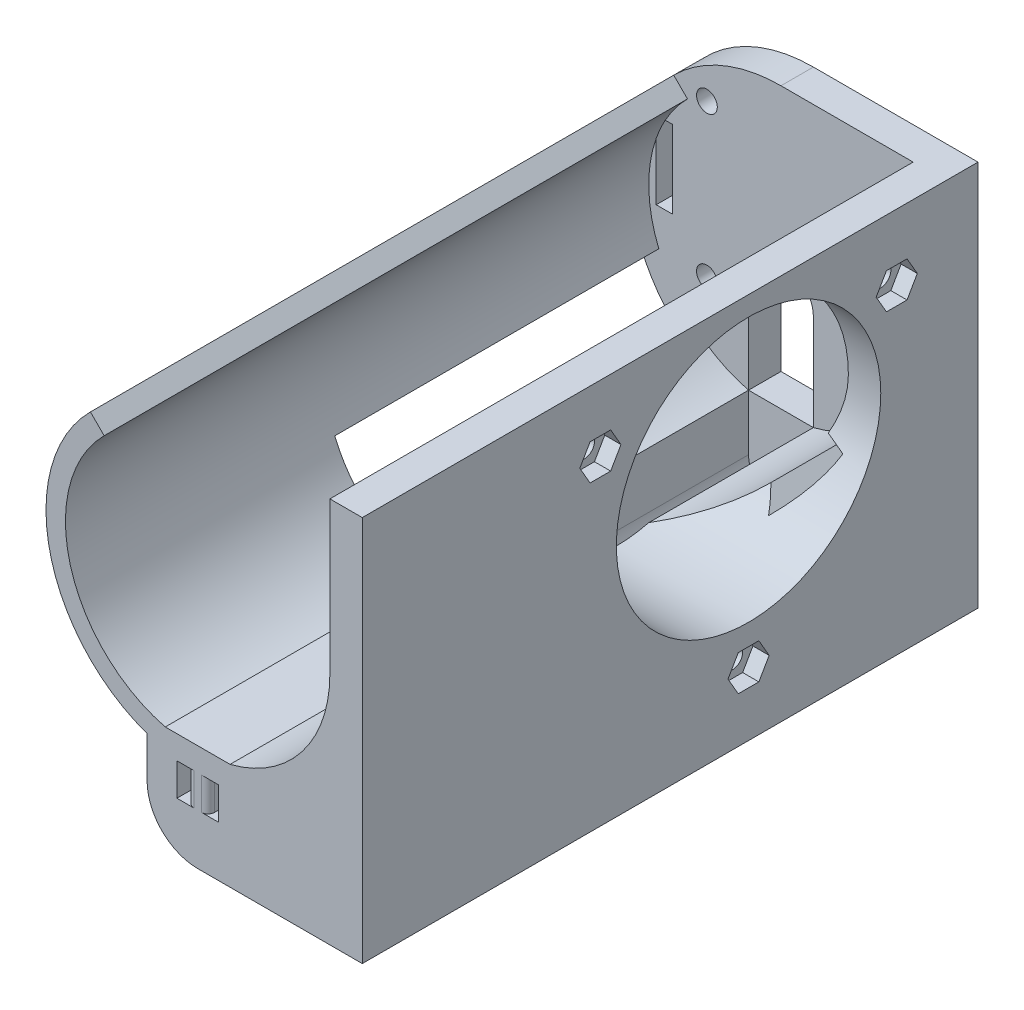
from build123d import *

# Parameters (mm, degrees)
BOSS_EXTRUDE3_DEPTH  = 40
BOSS_EXTRUDE7_START  = -50
BOSS_EXTRUDE7_DEPTH  = 50
BOSS_EXTRUDE8_START  = -3
SKETCH3_W            = 1.6
SKETCH3_H            = 5
BOSS_EXTRUDE8_DEPTH  = 3
SKETCH5_W            = 10
SKETCH5_H            = 3
BOSS_EXTRUDE9_DEPTH  = 37
BOSS_EXTRUDE10_START = -90
BOSS_EXTRUDE10_DEPTH = 90
SKETCH8_R            = 20.4
CUT_EXTRUDE1_DEPTH   = 67.750280898
CUT_EXTRUDE2_DEPTH   = 2.5
SKETCH10_R           = 1.6
CUT_EXTRUDE3_DEPTH   = 2.5
FILLET1_R            = 1
BOSS_EXTRUDE12_START = -50
BOSS_EXTRUDE12_DEPTH = 90
BOSS_EXTRUDE13_START = 5
BOSS_EXTRUDE13_DEPTH = 5
SKETCH12_R           = 1.6
CUT_EXTRUDE4_DEPTH   = 2.5
SKETCH12_4_R         = 1.6
SKETCH12_4_W         = 2.5
SKETCH12_4_H         = 12
CUT_EXTRUDE5_DEPTH   = 5


with BuildPart() as part:
    # Sketch1 → Boss-Extrude3 (new body)
    with BuildSketch(Plane.XY):
        with BuildLine():
            Line((8.954792317, -21.618781061), (7.80674202, -18.847142463))
            ThreePointArc((7.80674202, -18.847142463), (6.420255058, -19.363375868), (5, -19.777765293))
            Line((5, -19.777765293), (5, -28.4))
            ThreePointArc((5, -28.4), (0, -33.4), (-5, -28.4))
            Line((-5, -28.4), (-5, -19.777765293))
            ThreePointArc((-5, -19.777765293), (-6.420255058, -19.363375868), (-7.80674202, -18.847142463))
            Line((-7.80674202, -18.847142463), (-8.954792317, -21.618781061))
            ThreePointArc((-8.954792317, -21.618781061), (-8.380323245, -21.847887365), (-7.8, -22.061731573))
            Line((-7.8, -22.061731573), (-7.8, -28.4))
            ThreePointArc((-7.8, -28.4), (0, -36.2), (7.8, -28.4))
            Line((7.8, -28.4), (7.8, -22.061731573))
            ThreePointArc((7.8, -22.061731573), (8.380323245, -21.847887365), (8.954792317, -21.618781061))
        make_face()
        with BuildLine():
            Line((16.54629868, -16.54629868), (14.424978336, -14.424978336))
            ThreePointArc((14.424978336, -14.424978336), (11.333632754, -16.961980091), (7.80674202, -18.847142463))
            Line((7.80674202, -18.847142463), (8.954792317, -21.618781061))
            ThreePointArc((8.954792317, -21.618781061), (13.000343453, -19.456388928), (16.54629868, -16.54629868))
        make_face()
        with BuildLine():
            ThreePointArc((-7.80674202, -18.847142463), (-11.333632754, -16.961980091), (-14.424978336, -14.424978336))
            Line((-14.424978336, -14.424978336), (-16.54629868, -16.54629868))
            ThreePointArc((-16.54629868, -16.54629868), (-13.000343453, -19.456388928), (-8.954792317, -21.618781061))
            Line((-8.954792317, -21.618781061), (-7.80674202, -18.847142463))
        make_face()
        with BuildLine():
            ThreePointArc((-18.847142463, -7.80674202), (-20.00801972, -3.979842569), (-20.4, 0))
            Line((-20.4, 0), (-23.4, 0))
            ThreePointArc((-23.4, 0), (-22.950375561, -4.565113535), (-21.618781061, -8.954792317))
            Line((-21.618781061, -8.954792317), (-18.847142463, -7.80674202))
        make_face()
        with BuildLine():
            Line((21.618781061, -8.954792317), (18.847142463, -7.80674202))
            ThreePointArc((18.847142463, -7.80674202), (16.961980091, -11.333632754), (14.424978336, -14.424978336))
            Line((14.424978336, -14.424978336), (16.54629868, -16.54629868))
            ThreePointArc((16.54629868, -16.54629868), (19.456388928, -13.000343453), (21.618781061, -8.954792317))
        make_face()
        with BuildLine():
            Line((23.4, 0), (20.4, 0))
            ThreePointArc((20.4, 0), (20.00801972, -3.979842569), (18.847142463, -7.80674202))
            Line((18.847142463, -7.80674202), (21.618781061, -8.954792317))
            ThreePointArc((21.618781061, -8.954792317), (22.950375561, -4.565113535), (23.4, 0))
        make_face()
        with BuildLine():
            ThreePointArc((-14.424978336, -14.424978336), (-16.961980091, -11.333632754), (-18.847142463, -7.80674202))
            Line((-18.847142463, -7.80674202), (-21.618781061, -8.954792317))
            ThreePointArc((-21.618781061, -8.954792317), (-19.456388928, -13.000343453), (-16.54629868, -16.54629868))
            Line((-16.54629868, -16.54629868), (-14.424978336, -14.424978336))
        make_face()
    extrude(amount=BOSS_EXTRUDE3_DEPTH)

    # Sketch1<12> → Boss-Extrude7 (add)
    with BuildSketch(Plane.XY.offset(BOSS_EXTRUDE7_START)):
        with BuildLine():
            Line((16.54629868, -16.54629868), (14.424978336, -14.424978336))
            ThreePointArc((14.424978336, -14.424978336), (11.333632754, -16.961980091), (7.80674202, -18.847142463))
            Line((7.80674202, -18.847142463), (8.954792317, -21.618781061))
            ThreePointArc((8.954792317, -21.618781061), (13.000343453, -19.456388928), (16.54629868, -16.54629868))
        make_face()
        with BuildLine():
            Line((8.954792317, -21.618781061), (7.80674202, -18.847142463))
            ThreePointArc((7.80674202, -18.847142463), (6.420255058, -19.363375868), (5, -19.777765293))
            Line((5, -19.777765293), (5, -28.4))
            ThreePointArc((5, -28.4), (0, -33.4), (-5, -28.4))
            Line((-5, -28.4), (-5, -19.777765293))
            ThreePointArc((-5, -19.777765293), (-6.420255058, -19.363375868), (-7.80674202, -18.847142463))
            Line((-7.80674202, -18.847142463), (-8.954792317, -21.618781061))
            ThreePointArc((-8.954792317, -21.618781061), (-8.380323245, -21.847887365), (-7.8, -22.061731573))
            Line((-7.8, -22.061731573), (-7.8, -28.4))
            ThreePointArc((-7.8, -28.4), (0, -36.2), (7.8, -28.4))
            Line((7.8, -28.4), (7.8, -22.061731573))
            ThreePointArc((7.8, -22.061731573), (8.380323245, -21.847887365), (8.954792317, -21.618781061))
        make_face()
        with BuildLine():
            ThreePointArc((-18.847142463, -7.80674202), (-20.00801972, -3.979842569), (-20.4, 0))
            Line((-20.4, 0), (-23.4, 0))
            ThreePointArc((-23.4, 0), (-22.950375561, -4.565113535), (-21.618781061, -8.954792317))
            Line((-21.618781061, -8.954792317), (-18.847142463, -7.80674202))
        make_face()
        with BuildLine():
            Line((23.4, 0), (20.4, 0))
            ThreePointArc((20.4, 0), (20.00801972, -3.979842569), (18.847142463, -7.80674202))
            Line((18.847142463, -7.80674202), (21.618781061, -8.954792317))
            ThreePointArc((21.618781061, -8.954792317), (22.950375561, -4.565113535), (23.4, 0))
        make_face()
        with BuildLine():
            ThreePointArc((-7.80674202, -18.847142463), (-11.333632754, -16.961980091), (-14.424978336, -14.424978336))
            Line((-14.424978336, -14.424978336), (-16.54629868, -16.54629868))
            ThreePointArc((-16.54629868, -16.54629868), (-13.000343453, -19.456388928), (-8.954792317, -21.618781061))
            Line((-8.954792317, -21.618781061), (-7.80674202, -18.847142463))
        make_face()
    extrude(amount=BOSS_EXTRUDE7_DEPTH)

    # Sketch3 → Boss-Extrude8 (add)
    with BuildSketch(Plane.XY.offset(40).offset(BOSS_EXTRUDE8_START)):
        with BuildLine():
            Line((-5, -19.777765293), (5, -19.777765293))
            Line((5, -19.777765293), (5, -28.4))
            ThreePointArc((5, -28.4), (0, -33.4), (-5, -28.4))
            Line((-5, -28.4), (-5, -19.777765293))
        make_face()
        with Locations((2.4, -25.9)):
            Rectangle(SKETCH3_W, SKETCH3_H, mode=Mode.SUBTRACT)
        with Locations((-2.4, -25.9)):
            Rectangle(SKETCH3_W, SKETCH3_H, mode=Mode.SUBTRACT)
    extrude(amount=BOSS_EXTRUDE8_DEPTH)

    # Sketch5 → Boss-Extrude9 (add)
    with BuildSketch(Plane(origin=(0, 0, 37), x_dir=(-1, 0, 0), z_dir=(0, 0, -1))):
        with Locations((0, -21.277765293)):
            Rectangle(SKETCH5_W, SKETCH5_H)
    extrude(amount=BOSS_EXTRUDE9_DEPTH)

    # Sketch6 → Boss-Extrude10 (add)
    with BuildSketch(Plane.XY.offset(40).offset(BOSS_EXTRUDE10_START)):
        with BuildLine():
            Line((20.4, 0), (20.4, 23.4))
            Line((20.4, 23.4), (25.4, 23.4))
            Line((25.4, 23.4), (25.4, -36.2))
            Line((25.4, -36.2), (0, -36.2))
            ThreePointArc((0, -36.2), (5.515432893, -33.915432893), (7.8, -28.4))
            Line((7.8, -28.4), (7.8, -22.061731573))
            ThreePointArc((7.8, -22.061731573), (19.106019994, -13.509996299), (23.4, 0))
            Line((23.4, 0), (20.4, 0))
        make_face()
    extrude(amount=BOSS_EXTRUDE10_DEPTH)

    # Sketch8 → Cut-Extrude1 (cut, through all)
    with BuildSketch(Plane(origin=(0, 0, 0), x_dir=(0, 0, -1), z_dir=(1, 0, 0))):
        with Locations((19.6, 0)):
            Circle(SKETCH8_R)
    extrude(amount=CUT_EXTRUDE1_DEPTH, mode=Mode.SUBTRACT)

    # Sketch9 → Cut-Extrude2 (cut)
    with BuildSketch(Plane(origin=(25.4, 0, 0), x_dir=(0, 0, -1), z_dir=(1, 0, 0))):
        Polygon((18.01228676, -29.15), (21.18771324, -29.15), (22.775426481, -26.4), (21.18771324, -23.65), (18.01228676, -23.65), (16.424573519, -26.4), align=None)
        Polygon((-4.8507839, 10.45), (-1.67535742, 10.45), (-0.087644179, 13.2), (-1.67535742, 15.95), (-4.8507839, 15.95), (-6.43849714, 13.2), align=None)
        Polygon((40.87535742, 15.95), (39.287644179, 13.2), (40.87535742, 10.45), (44.0507839, 10.45), (45.63849714, 13.2), (44.0507839, 15.95), align=None)
    extrude(amount=-CUT_EXTRUDE2_DEPTH, mode=Mode.SUBTRACT)

    # Sketch10 → Cut-Extrude3 (cut)
    with BuildSketch(Plane(origin=(22.9, 0, 0), x_dir=(0, 0, -1), z_dir=(1, 0, 0))):
        with BuildLine():
            ThreePointArc((21.2, -26.4), (20.73137085, -25.26862915), (19.6, -24.8))
            Line((19.6, -24.8), (19.6, -28))
            ThreePointArc((19.6, -28), (20.73137085, -27.53137085), (21.2, -26.4))
        make_face()
        with BuildLine():
            Line((19.6, -28), (19.6, -24.8))
            ThreePointArc((19.6, -24.8), (18, -26.4), (19.6, -28))
        make_face()
        with Locations(Location((-3.26307066, 13.2, 0), (0, 0, 90))):
            Circle(SKETCH10_R)
        with Locations(Location((42.46307066, 13.2, 0), (0, 0, 90))):
            Circle(SKETCH10_R)
    extrude(amount=-CUT_EXTRUDE3_DEPTH, mode=Mode.SUBTRACT)

    # Fillet1
    # the kernel refuses this fillet: 1 mm, written as the material it adds along each edge
    with BuildSketch(Plane(origin=(-7.5, -22.777765293, 37), x_dir=(0, 0, -1), z_dir=(1, 0, 0))) as fillet1_piece_1_section:
        with BuildLine():
            CenterArc((FILLET1_R, -FILLET1_R), FILLET1_R, 90, 90)
            Line((0, -FILLET1_R), (0, 0))
            Line((0, 0), (FILLET1_R, 0))
        make_face()
    fillet1_piece_1 = extrude(amount=15, mode=Mode.PRIVATE)
    fillet1_piece_1 = split(fillet1_piece_1, bisect_by=Plane(origin=(-4.1, -23.4, 36.767628844), z_dir=(0, 1, 0)), keep=Keep.TOP, mode=Mode.PRIVATE)
    add(fillet1_piece_1)
    with BuildSketch(Plane(origin=(-7.5, -22.777765293, 37), x_dir=(0, 0, -1), z_dir=(1, 0, 0))) as fillet1_piece_2_section:
        with BuildLine():
            CenterArc((FILLET1_R, -FILLET1_R), FILLET1_R, 90, 90)
            Line((0, -FILLET1_R), (0, 0))
            Line((0, 0), (FILLET1_R, 0))
        make_face()
    fillet1_piece_2 = extrude(amount=15, mode=Mode.PRIVATE)
    fillet1_piece_2 = split(fillet1_piece_2, bisect_by=Plane(origin=(-3.2, -23.493727337, 36.977919101), z_dir=(-1, 0, 0)), keep=Keep.TOP, mode=Mode.PRIVATE)
    add(fillet1_piece_2)
    with BuildSketch(Plane(origin=(-7.5, -22.777765293, 37), x_dir=(0, 0, -1), z_dir=(1, 0, 0))) as fillet1_piece_3_section:
        with BuildLine():
            CenterArc((FILLET1_R, -FILLET1_R), FILLET1_R, 90, 90)
            Line((0, -FILLET1_R), (0, 0))
            Line((0, 0), (FILLET1_R, 0))
        make_face()
    fillet1_piece_3 = extrude(amount=15, mode=Mode.PRIVATE)
    fillet1_piece_3 = split(fillet1_piece_3, bisect_by=Plane(origin=(-1.6, -23.493727337, 36.977919101), z_dir=(1, 0, 0)), keep=Keep.TOP, mode=Mode.PRIVATE)
    fillet1_piece_3 = split(fillet1_piece_3, bisect_by=Plane(origin=(1.6, -23.493727337, 36.977919101), z_dir=(-1, 0, 0)), keep=Keep.TOP, mode=Mode.PRIVATE)
    add(fillet1_piece_3)
    with BuildSketch(Plane(origin=(-7.5, -22.777765293, 37), x_dir=(0, 0, -1), z_dir=(1, 0, 0))) as fillet1_piece_4_section:
        with BuildLine():
            CenterArc((FILLET1_R, -FILLET1_R), FILLET1_R, 90, 90)
            Line((0, -FILLET1_R), (0, 0))
            Line((0, 0), (FILLET1_R, 0))
        make_face()
    fillet1_piece_4 = extrude(amount=15, mode=Mode.PRIVATE)
    fillet1_piece_4 = split(fillet1_piece_4, bisect_by=Plane(origin=(3.2, -23.493727337, 36.977919101), z_dir=(1, 0, 0)), keep=Keep.TOP, mode=Mode.PRIVATE)
    add(fillet1_piece_4)
    with BuildSketch(Plane(origin=(-5, -28.4, 37), x_dir=(0, 0, -1), z_dir=(0, 1, 0)), Plane(origin=(5, -20.277765293, 37), x_dir=(0, 0, -1), z_dir=(0, -1, 0))) as fillet1_piece_5:
        with BuildLine():
            CenterArc((FILLET1_R, -FILLET1_R), FILLET1_R, 90, 90)
            Line((0, -FILLET1_R), (0, 0))
            Line((0, 0), (FILLET1_R, 0))
        make_face()
    extrude(amount=8.122234707)
    with BuildSketch(Plane(origin=(0, -28.4, 37), x_dir=(1, 0, 0), z_dir=(0, 1, 0))) as fillet1_piece_6:
        with BuildLine():
            CenterArc((5 - FILLET1_R, FILLET1_R), FILLET1_R, 270, 90)
            Line((5 - FILLET1_R, 0), (5, 0))
            Line((5, 0), (5, FILLET1_R))
        make_face()
    revolve(axis=Axis((0, -28.4, 37), (0, 0, -1)), revolution_arc=180)
    # the kernel refuses this fillet: 1 mm, written as the material it takes off along each edge
    with BuildSketch(Plane(origin=(1.6, -23.4, 40), x_dir=(-1, 0, 0), z_dir=(0, -1, 0))) as fillet1_2_piece_1:
        with BuildLine():
            CenterArc((FILLET1_R, FILLET1_R), FILLET1_R, 180, 90)
            Line((0, FILLET1_R), (0, 0))
            Line((0, 0), (FILLET1_R, 0))
        make_face()
    extrude(amount=5, mode=Mode.SUBTRACT)
    with BuildSketch(Plane(origin=(-1.6, -23.4, 40), x_dir=(1, 0, 0), z_dir=(0, -1, 0))) as fillet1_2_piece_2:
        with BuildLine():
            CenterArc((FILLET1_R, -FILLET1_R), FILLET1_R, 90, 90)
            Line((0, -FILLET1_R), (0, 0))
            Line((0, 0), (FILLET1_R, 0))
        make_face()
    extrude(amount=5, mode=Mode.SUBTRACT)

    # Sketch1<13> → Boss-Extrude12 (add)
    with BuildSketch(Plane.XY.offset(BOSS_EXTRUDE12_START)):
        with BuildLine():
            ThreePointArc((-20.4, 0), (-20.00801972, 3.979842569), (-18.847142463, 7.80674202))
            Line((-18.847142463, 7.80674202), (-21.618781061, 8.954792317))
            ThreePointArc((-21.618781061, 8.954792317), (-22.950375561, 4.565113535), (-23.4, 0))
            Line((-23.4, 0), (-20.4, 0))
        make_face()
        with BuildLine():
            ThreePointArc((-18.847142463, 7.80674202), (-16.961980091, 11.333632754), (-14.424978336, 14.424978336))
            Line((-14.424978336, 14.424978336), (-16.54629868, 16.54629868))
            ThreePointArc((-16.54629868, 16.54629868), (-19.456388928, 13.000343453), (-21.618781061, 8.954792317))
            Line((-21.618781061, 8.954792317), (-18.847142463, 7.80674202))
        make_face()
    extrude(amount=BOSS_EXTRUDE12_DEPTH)

    # Sketch11 → Boss-Extrude13 (add)
    with BuildSketch(Plane(origin=(0, 0, -50), x_dir=(-1, 0, 0), z_dir=(0, 0, -1)).offset(BOSS_EXTRUDE13_START)):
        with BuildLine():
            ThreePointArc((7.8, -22.061731573), (23.063006296, 3.956986302), (0, 23.4))
            Line((0, 23.4), (-25.4, 23.4))
            Line((-25.4, 23.4), (-25.4, -36.2))
            Line((-25.4, -36.2), (0, -36.2))
            ThreePointArc((0, -36.2), (5.515432893, -33.915432893), (7.8, -28.4))
            Line((7.8, -28.4), (7.8, -22.061731573))
        make_face()
        with BuildLine():
            ThreePointArc((-5, -5), (0, 0), (5, -5))
            Line((5, -5), (5, -19.777765293))
            Line((5, -19.777765293), (-5, -19.777765293))
            Line((-5, -19.777765293), (-5, -5))
        make_face(mode=Mode.SUBTRACT)
    extrude(amount=-BOSS_EXTRUDE13_DEPTH)

    # Sketch12 → Cut-Extrude4 (cut)
    # profile 1 of 4: a face of its own
    with BuildSketch(Plane(origin=(0, 0, -55), x_dir=(-1, 0, 0), z_dir=(0, 0, -1))):
        Polygon((8.25, 15.622234707), (9.83771324, 12.872234707), (13.013139721, 12.872234707), (14.600852961, 15.622234707), (13.013139721, 18.372234707), (9.83771324, 18.372234707), align=None)
        with Locations((11.425426481, 15.622234707)):
            Circle(SKETCH12_R, mode=Mode.SUBTRACT)
    # profile 2 of 4: a face of its own
    with BuildSketch(Plane(origin=(0, 0, -55), x_dir=(-1, 0, 0), z_dir=(0, 0, -1))):
        with Locations((11.425426481, 15.622234707)):
            Circle(SKETCH12_R)
    # profile 3 of 4: a face of its own
    with BuildSketch(Plane(origin=(0, 0, -55), x_dir=(-1, 0, 0), z_dir=(0, 0, -1))):
        Polygon((14.600852961, -7.877765293), (13.013139721, -5.127765293), (9.83771324, -5.127765293), (8.25, -7.877765293), (9.83771324, -10.627765293), (13.013139721, -10.627765293), align=None)
        with Locations((11.425426481, -7.877765293)):
            Circle(SKETCH12_R, mode=Mode.SUBTRACT)
    # profile 4 of 4: a face of its own
    with BuildSketch(Plane(origin=(0, 0, -55), x_dir=(-1, 0, 0), z_dir=(0, 0, -1))):
        with Locations((11.425426481, -7.877765293)):
            Circle(SKETCH12_R)
    extrude(amount=-CUT_EXTRUDE4_DEPTH, mode=Mode.SUBTRACT)

    # Sketch12<4> → Cut-Extrude5 (cut)
    with BuildSketch(Plane(origin=(0, 0, -55), x_dir=(-1, 0, 0), z_dir=(0, 0, -1))):
        with Locations((11.425426481, 15.622234707)):
            Circle(SKETCH12_4_R)
        with Locations((11.425426481, -7.877765293)):
            Circle(SKETCH12_4_R)
        with Locations((18, 3.872234707)):
            Rectangle(SKETCH12_4_W, SKETCH12_4_H)
    extrude(amount=-CUT_EXTRUDE5_DEPTH, mode=Mode.SUBTRACT)


solid = part.part
